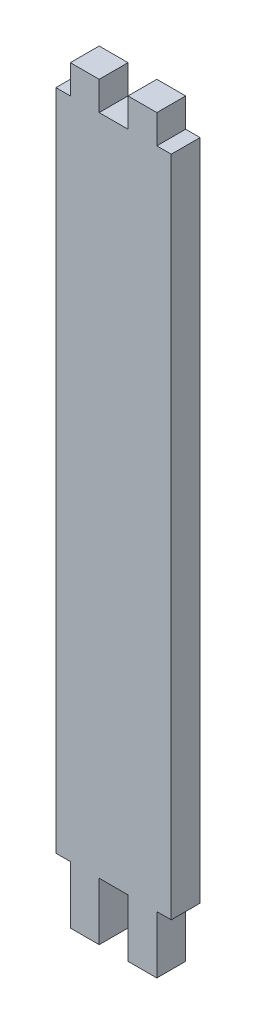
from build123d import *

# Parameters (mm, degrees)
BOSS_EXTRUDE1_DEPTH = 5


with BuildPart() as part:
    # Sketch1 → Boss-Extrude1 (new body)
    with BuildSketch(Plane.XY):
        Polygon((-7.5, 57.5), (-7.5, 62.5), (-2.5, 62.5), (-2.5, 57.5), (2.5, 57.5), (2.5, 62.5), (7.5, 62.5), (7.5, 57.5), (10, 57.5), (10, -57.5), (7.5, -57.5), (7.5, -62.5), (7.5, -67.486496431), (2.5, -67.486496431), (2.5, -62.5), (2.5, -57.5), (-2.5, -57.5), (-2.5, -62.5), (-2.5, -67.486496431), (-7.5, -67.486496431), (-7.5, -62.486496431), (-7.5, -57.5), (-10, -57.5), (-10, 57.5), align=None)
    extrude(amount=BOSS_EXTRUDE1_DEPTH)


solid = part.part
